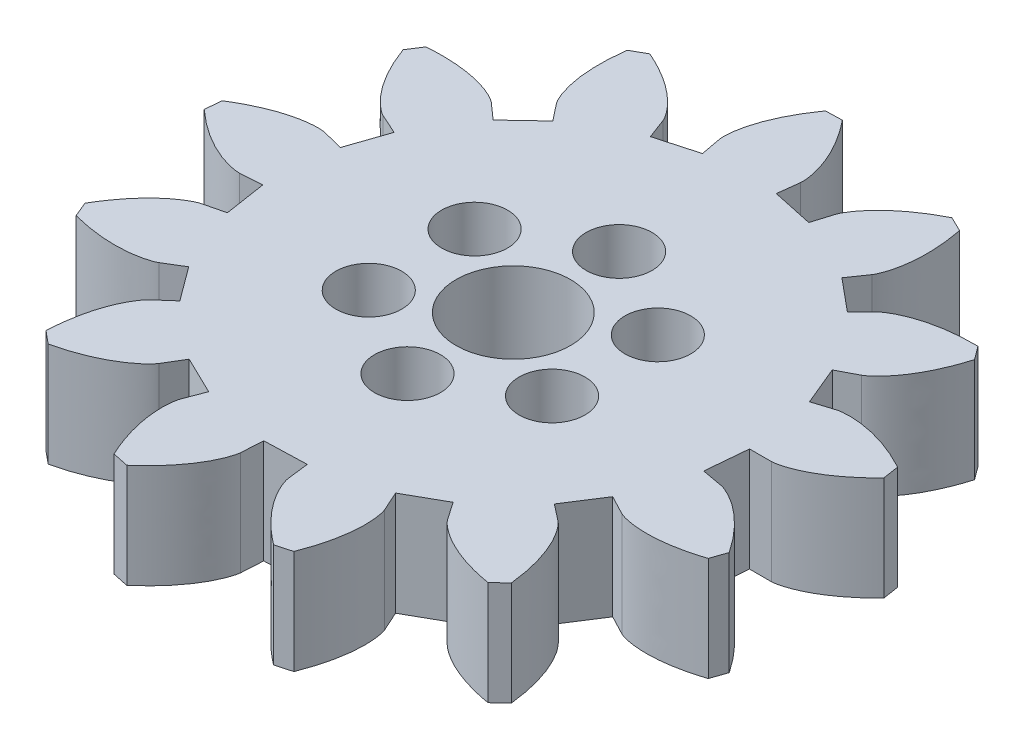
from build123d import *

# Parameters (mm, degrees)
BOSS_EXTRUDE1_DEPTH = 1.5
CIRPATTERN1_COUNT   = 13
SKETCH3_R           = 0.95
SKETCH3_R_2         = 1.65
CUT_EXTRUDE1_DEPTH  = 14.816151508


with BuildPart() as part:
    # Sketch4 → Boss-Extrude1 (new, symmetric)
    with BuildSketch(Plane(origin=(0, 0, 0), x_dir=(1, 0, 0), z_dir=(0, 1, 0))):
        with BuildLine():
            Line((0, 0), (6.263275645, 2.602750232))
            Line((6.263275645, 2.602750232), (6.496786874, 2.040833527))
            Line((6.496786874, 2.040833527), (7.095523768, 2.228900768))
            add(Edge.make_bspline(
                [(7.095523768, 2.228900768), (7.241865653, 2.274867728), (8.101851863, 2.383646686), (9.397063968, 1.682132101)],
                knots=[0, 0, 0, 0, 1, 1, 1, 1], degree=3))
            Line((9.397063968, 1.682132101), (9.433162207, 1.44676802))
            Line((9.433162207, 1.44676802), (9.469259758, 1.211403835))
            add(Edge.make_bspline(
                [(7.437368902, 1.5039e-05), (7.59076026, 1.8292e-05), (8.443818359, 0.153969654), (9.469259758, 1.211403835)],
                knots=[0, 0, 0, 0, 1, 1, 1, 1], degree=3))
            Line((7.437368902, 1.5039e-05), (6.809790098, 1.731e-06))
            Line((6.809790098, 1.731e-06), (6.755413504, -0.606068449))
            Line((6.755413504, -0.606068449), (0, 0))
        make_face()
    boss_extrude1 = extrude(amount=BOSS_EXTRUDE1_DEPTH, both=True)

    # CirPattern1: Boss-Extrude1 ×13 about axis
    cirpattern1_axis = Axis((0, -1.5, 0), (0, 1, 0))
    for i in range(1, CIRPATTERN1_COUNT):
        add(boss_extrude1.rotate(cirpattern1_axis, i * 360 / CIRPATTERN1_COUNT))

    # Sketch3 → Cut-Extrude1 (cut, through all)
    with BuildSketch(Plane(origin=(0, 1.5, 0), x_dir=(1, 0, 0), z_dir=(0, 1, 0))):
        with Locations((-2.641377482, -1.525)):
            Circle(SKETCH3_R)
        with Locations((0, -3.05)):
            Circle(SKETCH3_R)
        with Locations((2.641377482, -1.525)):
            Circle(SKETCH3_R)
        with Locations((2.641377482, 1.525)):
            Circle(SKETCH3_R)
        with Locations((0, 3.05)):
            Circle(SKETCH3_R)
        with Locations((-2.641377482, 1.525)):
            Circle(SKETCH3_R)
        Circle(SKETCH3_R_2)
    extrude(amount=-CUT_EXTRUDE1_DEPTH, mode=Mode.SUBTRACT)


solid = part.part
